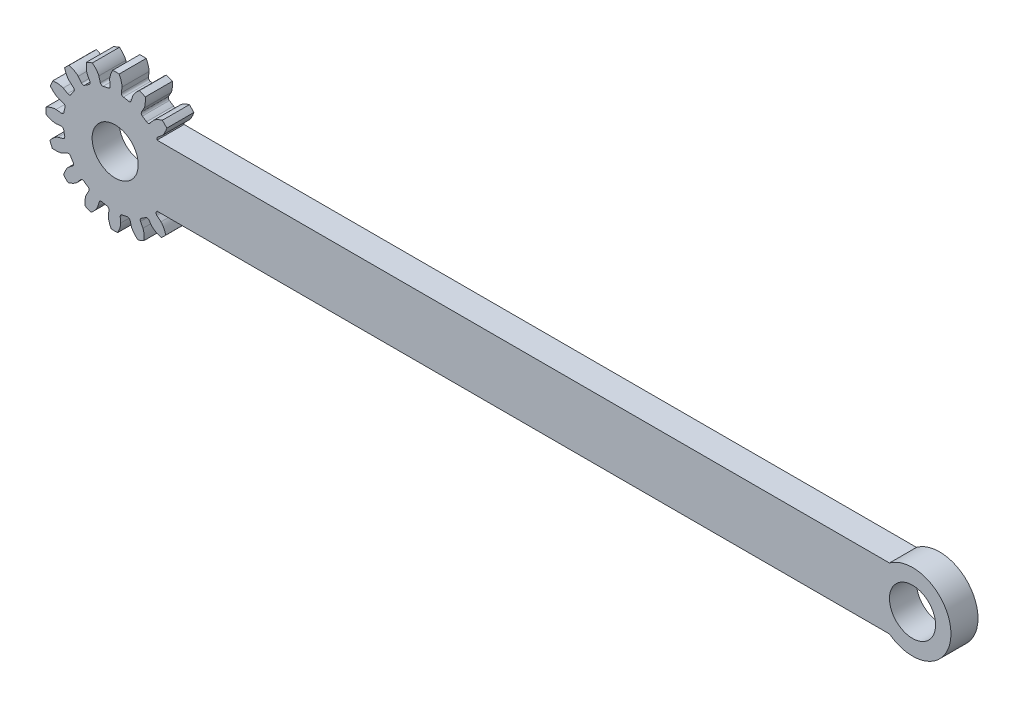
from build123d import *

# Parameters (mm, degrees)
BOSS_EXTRUDE1_DEPTH      = 5.588
CUT_EXTRUDE1_DEPTH       = 174.299858936
FILLET1_R                = 0.496244564
CIRPATTERN1_COUNT        = 16
FILLET1_OF_CIRPATTERN1_R = 0.496244564
SKETCH4_W                = 5.588
SKETCH4_H                = 12.7
BOSS_EXTRUDE2_DEPTH      = 5.08
SKETCH5_R                = 4.7625
CUT_EXTRUDE2_DEPTH       = 174.299859047


with BuildPart() as part:
    # Sketch1 → Boss-Extrude1 (new body)
    with BuildSketch(Plane.XY):
        with BuildLine():
            Line((12.798834175, -6.35), (159.919473719, -6.35))
            ThreePointArc((159.919473719, -6.35), (172.619473719, 0), (159.919473719, 6.35))
            Line((159.919473719, 6.35), (12.798834175, 6.35))
            ThreePointArc((12.798834175, 6.35), (-14.2875, 0), (12.798834175, -6.35))
        make_face()
    extrude(amount=BOSS_EXTRUDE1_DEPTH)

    # Sketch3 → Cut-Extrude1 (cut, through all)
    with BuildSketch(Plane.XY.offset(5.588)):
        with BuildLine():
            Line((10.304535783, 2.93958525), (11.823777189, 3.372980769))
            add(Edge.make_bspline(
                [(11.823777189, 3.372980769), (11.826828122, 3.373892569), (11.835350142, 3.376568337), (11.851321191, 3.382094065), (11.877172543, 3.391770902), (11.909795337, 3.405068504), (11.951582688, 3.42336192), (12.000307705, 3.446328962), (12.053311702, 3.473046741), (12.110372018, 3.503701368), (12.166747224, 3.535680762), (12.222457493, 3.568875739), (12.277469218, 3.603106176), (12.343518338, 3.645937307), (12.421890668, 3.699191843), (12.51225172, 3.764180094), (12.613236283, 3.84110705), (12.714502029, 3.922921917), (12.812770185, 4.006222816), (12.910423586, 4.093569134), (13.00374758, 4.180333952), (13.098951244, 4.273675723), (13.185952071, 4.361475552), (13.28145445, 4.463366885), (13.35795476, 4.546626366), (13.435301406, 4.635544323), (13.472697325, 4.679249473), (13.491703323, 4.70176538)],
                knots=[0, 0, 0, 0, 0, 0.005376749, 0.015083688, 0.02853182, 0.04661014, 0.064854849, 0.092110526, 0.119476176, 0.146842496, 0.174208854, 0.201574956, 0.228941013, 0.256307345, 0.307035032, 0.361767352, 0.416499661, 0.471231937, 0.525964282, 0.580696616, 0.635428982, 0.690161387, 0.744893688, 0.799626082, 0.854358407, 0.909090915, 0.909090915, 0.909090915, 0.909090915, 0.909090915], degree=4))
            ThreePointArc((13.491703323, 4.70176538), (14.043018272, 2.631785339), (14.278655565, 0.502644525))
            add(Edge.make_bspline(
                [(12.242763285, 1.137300936), (12.245937342, 1.137555753), (12.254849948, 1.138147388), (12.271738056, 1.138779756), (12.299339098, 1.139120368), (12.334563147, 1.138537862), (12.380138823, 1.136617047), (12.433873689, 1.132851889), (12.492955303, 1.127139941), (12.557243503, 1.119227096), (12.621372784, 1.109831304), (12.685322412, 1.099061646), (12.748995841, 1.087073853), (12.826071969, 1.071065653), (12.918409361, 1.049803624), (13.026170688, 1.021945252), (13.148157611, 0.986805116), (13.272176548, 0.947210583), (13.393939406, 0.905145435), (13.516594072, 0.85908679), (13.635002567, 0.812002506), (13.757544691, 0.759468213), (13.87043389, 0.709129536), (13.996350253, 0.648734026), (14.097807449, 0.59882535), (14.202102483, 0.543948644), (14.252786319, 0.516750416), (14.278655565, 0.502644525)],
                knots=[0, 0, 0, 0, 0, 0.005376749, 0.015083688, 0.02853182, 0.04661014, 0.064854849, 0.092110526, 0.119476176, 0.146842496, 0.174208854, 0.201574956, 0.228941013, 0.256307345, 0.307035032, 0.361767352, 0.416499661, 0.471231937, 0.525964282, 0.580696616, 0.635428982, 0.690161387, 0.744893688, 0.799626082, 0.854358407, 0.909090915, 0.909090915, 0.909090915, 0.909090915, 0.909090915], degree=4))
            Line((12.242763285, 1.137300936), (10.669686204, 0.991168727))
            ThreePointArc((10.669686204, 0.991168727), (10.532263704, 1.973839004), (10.304535783, 2.93958525))
        make_face()
    cut_extrude1 = extrude(amount=-CUT_EXTRUDE1_DEPTH, mode=Mode.SUBTRACT)

    # Fillet1
    fillet1_edges = [part.edges().sort_by_distance(p)[0] for p in [
        (10.304535783, 2.93958525, 2.794),
        (10.669686204, 0.991168727, 2.794),
    ]]
    fillet(fillet1_edges, radius=FILLET1_R)

    # CirPattern1: Cut-Extrude1 ×16 about axis
    cirpattern1_axis = Axis((0, 0, 5.588), (0, 0, 1))
    for i in range(1, CIRPATTERN1_COUNT):
        add(cut_extrude1.rotate(cirpattern1_axis, i * 360 / CIRPATTERN1_COUNT), mode=Mode.SUBTRACT)

    # Fillet1 of CirPattern1
    fillet1_of_cirpattern1_edges = [part.edges().sort_by_distance(p)[0] for p in [
        (8.395219128, 6.659197769, 2.794),
        (9.478200852, 4.998832639, 2.794),
        (5.207806465, 9.365007793, 2.794),
        (6.84374534, 8.245469596, 2.794),
        (1.227552476, 10.645080275, 2.794),
        (3.167391638, 10.236808553, 2.794),
        (-2.93958525, 10.304535783, 2.794),
        (-0.991168727, 10.669686204, 2.794),
        (-6.659197769, 8.395219128, 2.794),
        (-4.998832639, 9.478200852, 2.794),
        (-9.365007793, 5.207806465, 2.794),
        (-8.245469596, 6.84374534, 2.794),
        (-10.645080275, 1.227552476, 2.794),
        (-10.236808553, 3.167391638, 2.794),
        (-10.304535783, -2.93958525, 2.794),
        (-10.669686204, -0.991168727, 2.794),
        (-8.395219128, -6.659197769, 2.794),
        (-9.478200852, -4.998832639, 2.794),
        (-5.207806465, -9.365007793, 2.794),
        (-6.84374534, -8.245469596, 2.794),
        (-1.227552476, -10.645080275, 2.794),
        (-3.167391638, -10.236808553, 2.794),
        (2.93958525, -10.304535783, 2.794),
        (0.991168727, -10.669686204, 2.794),
        (6.659197769, -8.395219128, 2.794),
        (4.998832639, -9.478200852, 2.794),
        (9.365007793, -5.207806465, 2.794),
        (8.245469596, -6.84374534, 2.794),
        (10.645080275, -1.227552476, 2.794),
        (10.236808553, -3.167391638, 2.794),
    ]]
    fillet(fillet1_of_cirpattern1_edges, radius=FILLET1_OF_CIRPATTERN1_R)

    # Sketch4 → Boss-Extrude2 (add, symmetric)
    with BuildSketch(Plane(origin=(10.16, 0, 0), x_dir=(0, 0, -1), z_dir=(1, 0, 0))):
        with Locations((-2.794, 0)):
            Rectangle(SKETCH4_W, SKETCH4_H)
    extrude(amount=BOSS_EXTRUDE2_DEPTH, both=True)

    # Sketch5 → Cut-Extrude2 (cut, through all)
    with BuildSketch(Plane.XY.offset(5.588)):
        Circle(SKETCH5_R)
        with Locations((164.681973719, 0)):
            Circle(SKETCH5_R)
    extrude(amount=-CUT_EXTRUDE2_DEPTH, mode=Mode.SUBTRACT)


solid = part.part
